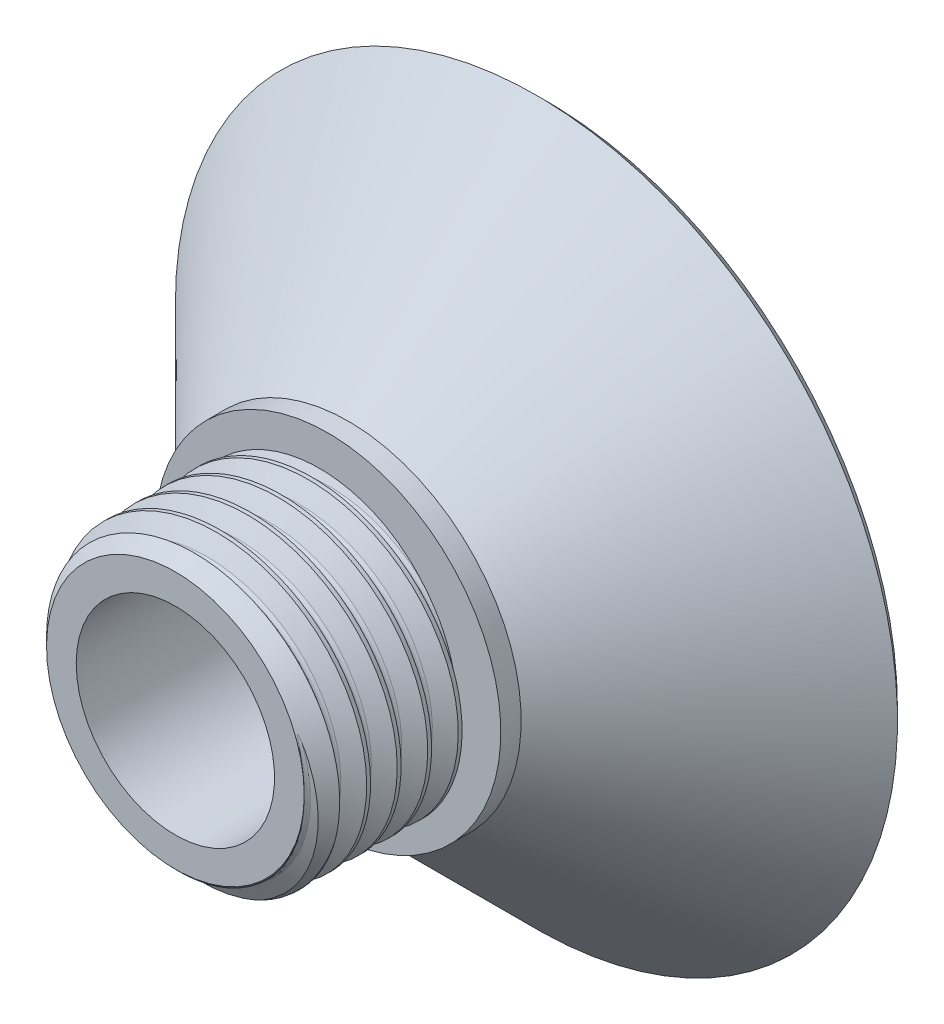
from build123d import *

# Parameters (mm, degrees)
SWEEP5_PITCH            = 3
CUT_EXTRUDE1_DEPTH      = 64.880748335
CUT_EXTRUDE1_DEPTH_BACK = 64.880748335
CHAMFER1_SIZE           = 1


with BuildPart() as part:
    # Sketch1 → Revolve1 (revolve)
    with BuildSketch(Plane(origin=(0, 0, 0), x_dir=(0, 0, -1), z_dir=(1, 0, 0)), mode=Mode.PRIVATE) as revolve1_sk:
        Polygon((0, 2.85), (0, 35.5), (-1, 35.5), (-19.5, 17), (-21.5, 17), (-21.5, 12.67), (-36.5, 12.67), (-36.5, 9.75), (-3.3, 9.75), (-3.3, 2.85), align=None)
    revolve(revolve1_sk.sketch.rotate(Axis((0, 0, 0), (0, 0, 1)), 90), axis=Axis((0, 0, 0), (0, 0, 1)))

    # Sweep5: arcs per turn and ends read off the stored shape
    # Sweep5: the profile of Sketch4 profile screwed along a right-hand helix through 6 turns, 10 arcs to a turn; built about Z, then put on its axis
    sweep5_z = Axis((0, 0, 0), (0, 0, 1))
    sweep5_corners = [(12.886, 0, -0.374122974), (14.5, 0, -1.305966309), (14.5, 0, -1.684033691), (12.886, 0, -2.615877026), (12.67, 0, -2.99), (12.6697, 0, -2.99), (12.6697, 0, 0), (12.67, 0, 0)]
    with BuildLine(mode=Mode.PRIVATE) as sweep5_profile:
        Line(sweep5_corners[0], sweep5_corners[1])
        Line(sweep5_corners[1], sweep5_corners[2])
        Line(sweep5_corners[2], sweep5_corners[3])
        Line(sweep5_corners[5], sweep5_corners[6])
        Line(sweep5_corners[4], sweep5_corners[5])
        Line(sweep5_corners[7], sweep5_corners[6])
        ThreePointArc((12.886, 0, -2.615877026), (12.727877026, 0, -2.774), (12.67, 0, -2.99))
        ThreePointArc((12.67, 0, 0), (12.727877026, 0, -0.216), (12.886, 0, -0.374122974))
    sweep5_cap = Face(sweep5_profile.wire())
    sweep5_arcs = [((12.886, 0, -2.615877026), (12.67, 0, -2.740584684), (12.67, 0, -2.99), (1, 0.8660254037844132, 1)), ((12.67, 0, 0), (12.67, 0, -0.249415316), (12.886, 0, -0.374122974), (1, 0.8660254037844152, 1))]  # start, shoulder, end, weights
    sweep5_turn_angles = [0, 18, 36, 54, 72, 90, 108, 126, 144, 162, 180, 198, 216, 234, 252, 270, 288, 306, 324, 342, 360]
    sweep5_turn_weights = [1, 0.9510565162951535, 1, 0.9510565162951535, 1, 0.9510565162951535, 1, 0.9510565162951535, 1, 0.9510565162951535, 1, 0.9510565162951535, 1, 0.9510565162951535, 1, 0.9510565162951535, 1, 0.9510565162951535, 1, 0.9510565162951535, 1]
    sweep5_turn_rails = [Edge.make_bspline([Vector(p[0], p[1], 0).rotate(sweep5_z, sweep5_turn_angles[k]) / sweep5_turn_weights[k] + Vector(0, 0, p[2] + SWEEP5_PITCH * sweep5_turn_angles[k] / 360) for k in range(21)], [0, 0, 0, 1, 1, 2, 2, 3, 3, 4, 4, 5, 5, 6, 6, 7, 7, 8, 8, 9, 9, 10, 10, 10], 2, sweep5_turn_weights) for p in sweep5_corners]
    sweep5_turn_sides = [*[Face.make_surface_from_curves(sweep5_turn_rails[p[0]], sweep5_turn_rails[p[1]]) for p in [(0, 1), (1, 2), (2, 3), (5, 6), (4, 5), (7, 6)]], *[Face.make_bezier_surface([[Vector(p[j][0], p[j][1], 0).rotate(sweep5_z, sweep5_turn_angles[2 * i + k]) / sweep5_turn_weights[2 * i + k] + Vector(0, 0, p[j][2] + SWEEP5_PITCH * sweep5_turn_angles[2 * i + k] / 360) for k in range(3)] for j in range(3)], [[p[3][j] * sweep5_turn_weights[2 * i + k] for k in range(3)] for j in range(3)]) for p in sweep5_arcs for i in range(10)]]
    sweep5 = Plane(origin=(0, 0, 21.5), x_dir=(1, 0, 0), z_dir=(0, 0, 1)) * Solid(Shell([*[p.moved(Location((0, 0, SWEEP5_PITCH * i))) for i in range(6) for p in sweep5_turn_sides], sweep5_cap, sweep5_cap.rotate(sweep5_z, 2160).moved(Location((0, 0, SWEEP5_PITCH * 2160 / 360)))]))
    add(sweep5)

    # Sketch11 → Cut-Extrude1 (cut, two sides: drawn at the far end of the back side and taken through both)
    with BuildSketch(Plane(origin=(0, 0, 0), x_dir=(1, 0, 0), z_dir=(0, 1, 0)).offset(-CUT_EXTRUDE1_DEPTH_BACK)):
        Polygon((155.419999662, -36.5), (17.20325686, -36.5), (-17.023158961, -36.5), (-155.239901763, -36.5), (-155.239901763, -312.933485603), (155.419999662, -312.933485603), align=None)
    extrude(amount=CUT_EXTRUDE1_DEPTH + CUT_EXTRUDE1_DEPTH_BACK, mode=Mode.SUBTRACT)

    # Sketch12 → Cut-Revolve1 (revolve, cut)
    with BuildSketch(Plane(origin=(0, 0, 0), x_dir=(1, 0, 0), z_dir=(0, 1, 0))):
        Polygon((12.67, -36.5), (15.17, -34), (15.17, -36.5), align=None)
    revolve(axis=Axis((0, 0, 0), (0, 0, 1)), mode=Mode.SUBTRACT)

    # Chamfer1
    chamfer1_edges = [part.edges().sort_by_distance(p)[0] for p in [
        (35.5, 0, 0),
    ]]
    chamfer(chamfer1_edges, length=CHAMFER1_SIZE - 0.0001)  # a hair under: the kernel refuses the full size


solid = part.part
